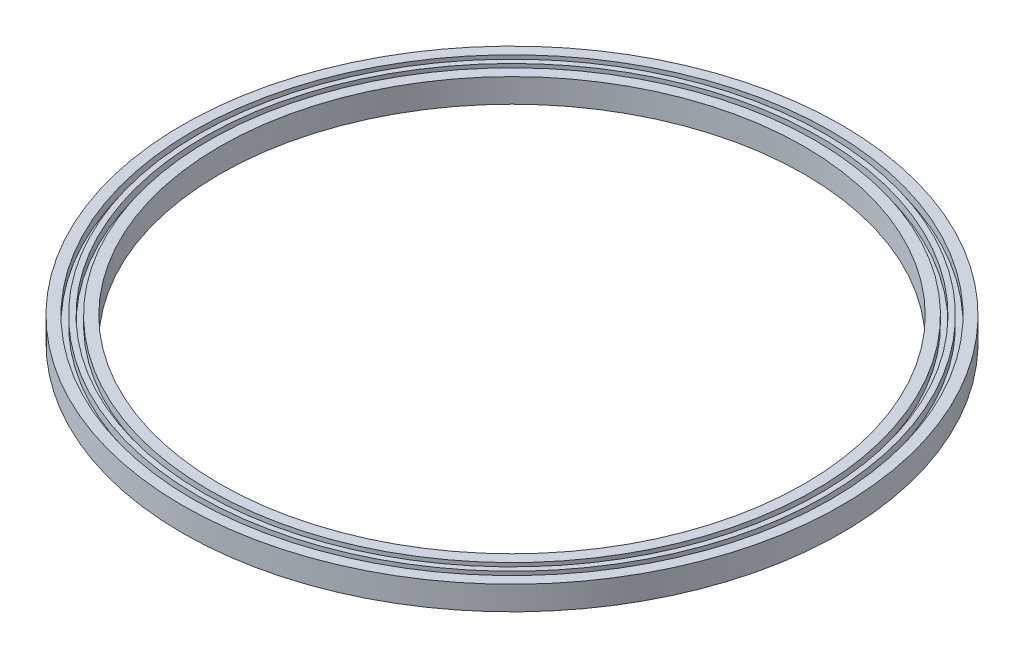
from build123d import *

# Parameters (mm, degrees)
SKETCH1_R           = 12000
SKETCH1_R_2         = 11400
BOSS_EXTRUDE1_DEPTH = 600
SKETCH2_R           = 11400
SKETCH2_R_2         = 10995.153620134
BOSS_EXTRUDE2_DEPTH = 900
SKETCH3_R           = 12400
SKETCH3_R_2         = 12000
BOSS_EXTRUDE3_DEPTH = 900
SKETCH4_R           = 12000
SKETCH4_R_2         = 11400
CUT_EXTRUDE2_DEPTH  = 400
SKETCH5_R           = 11798.47107243
SKETCH5_R_2         = 11600.158712044
BOSS_EXTRUDE4_DEPTH = 300


with BuildPart() as part:
    # Sketch1 → Boss-Extrude1 (new body)
    with BuildSketch(Plane(origin=(0, 0, 0), x_dir=(1, 0, 0), z_dir=(0, 1, 0))):
        Circle(SKETCH1_R)
        Circle(SKETCH1_R_2, mode=Mode.SUBTRACT)
    extrude(amount=BOSS_EXTRUDE1_DEPTH)

    # Sketch2 → Boss-Extrude2 (add)
    with BuildSketch(Plane(origin=(0, 0, 0), x_dir=(1, 0, 0), z_dir=(0, 1, 0))):
        Circle(SKETCH2_R)
        Circle(SKETCH2_R_2, mode=Mode.SUBTRACT)
    extrude(amount=BOSS_EXTRUDE2_DEPTH)

    # Sketch3 → Boss-Extrude3 (add)
    with BuildSketch(Plane(origin=(0, 0, 0), x_dir=(1, 0, 0), z_dir=(0, 1, 0))):
        Circle(SKETCH3_R)
        Circle(SKETCH3_R_2, mode=Mode.SUBTRACT)
    extrude(amount=BOSS_EXTRUDE3_DEPTH)

    # Sketch4 → Cut-Extrude2 (cut)
    with BuildSketch(Plane.XZ):
        Circle(SKETCH4_R)
        Circle(SKETCH4_R_2, mode=Mode.SUBTRACT)
    extrude(amount=-CUT_EXTRUDE2_DEPTH, mode=Mode.SUBTRACT)

    # Sketch5 → Boss-Extrude4 (add)
    with BuildSketch(Plane(origin=(0, 600, 0), x_dir=(1, 0, 0), z_dir=(0, 1, 0))):
        Circle(SKETCH5_R)
        Circle(SKETCH5_R_2, mode=Mode.SUBTRACT)
    extrude(amount=BOSS_EXTRUDE4_DEPTH)


solid = part.part
